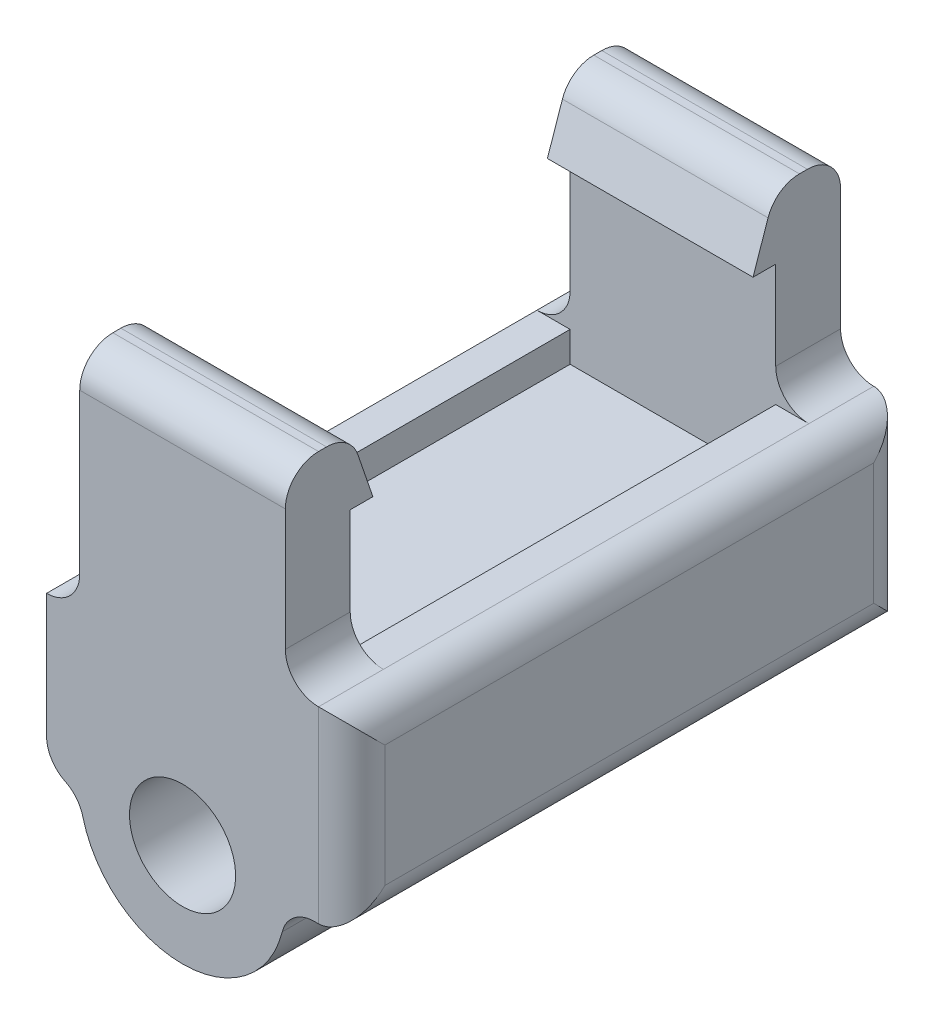
from build123d import *

# Parameters (mm, degrees)
ESBO_O1_R                = 3.1
ESBO_O1_R_2              = 1.55
RESSALTO_EXTRUS_O1_DEPTH = 16.74
BOSS_EXTRUDE1_DEPTH      = 16.74
SKETCH2_W                = 6.2
SKETCH2_H                = 1.955
BOSS_EXTRUDE2_DEPTH      = 7.715
BOSS_EXTRUDE3_DEPTH      = 6.2
SKETCH5_W                = 16.74
SKETCH5_H                = 5.66650546
BOSS_EXTRUDE4_DEPTH      = 2
SKETCH6_W                = 16.74
SKETCH6_H                = 4.529470895
BOSS_EXTRUDE5_DEPTH      = 1
FILLET1_R                = 1
FILLET4_R                = 1
M3_CLEARANCE_HOLE1_D     = 3.2


with BuildPart() as part:
    # Esboço1 → Ressalto-extrusão1 (new body)
    with BuildSketch(Plane.XY):
        with Locations((16.016666667, 16.016666667)):
            Circle(ESBO_O1_R)
        with Locations((16.016666667, 16.016666667)):
            Circle(ESBO_O1_R_2, mode=Mode.SUBTRACT)
    extrude(amount=RESSALTO_EXTRUS_O1_DEPTH)

    # Sketch1 → Boss-Extrude1 (add)
    with BuildSketch(Plane(origin=(0, 0, 0), x_dir=(-1, 0, 0), z_dir=(0, 0, -1))):
        with BuildLine():
            Line((-12.916666667, 16.016666667), (-12.916666667, 19.634677588))
            Line((-12.916666667, 19.634677588), (-19.116666667, 19.634677588))
            Line((-19.116666667, 19.634677588), (-19.116666667, 16.016666667))
            ThreePointArc((-19.116666667, 16.016666667), (-16.016666667, 19.116666667), (-12.916666667, 16.016666667))
        make_face()
    extrude(amount=-BOSS_EXTRUDE1_DEPTH)

    # Sketch2 → Boss-Extrude2 (add)
    with BuildSketch(Plane(origin=(0, 19.634677588, 0), x_dir=(1, 0, 0), z_dir=(0, 1, 0))):
        with Locations((16.016666667, -0.9775)):
            Rectangle(SKETCH2_W, SKETCH2_H)
        with Locations((16.016666667, -15.7625)):
            Rectangle(SKETCH2_W, SKETCH2_H)
    extrude(amount=BOSS_EXTRUDE2_DEPTH)

    # Sketch4 → Boss-Extrude3 (add)
    with BuildSketch(Plane.ZY.offset(-12.916666667)):
        Polygon((1.955, 27.349677588), (1.955, 25.349677588), (2.639300497, 25.349677588), align=None)
        Polygon((14.100699503, 25.349677588), (14.785, 27.349677588), (14.785, 25.349677588), align=None)
    extrude(amount=-BOSS_EXTRUDE3_DEPTH)

    # Sketch5 → Boss-Extrude4 (add)
    with BuildSketch(Plane(origin=(19.116666667, 0, 0), x_dir=(0, 0, -1), z_dir=(1, 0, 0))):
        with Locations((-8.37, 18.849919397)):
            Rectangle(SKETCH5_W, SKETCH5_H)
    extrude(amount=BOSS_EXTRUDE4_DEPTH)

    # Sketch6 → Boss-Extrude5 (add)
    with BuildSketch(Plane.ZY.offset(-12.916666667)):
        with Locations((8.37, 18.281402115)):
            Rectangle(SKETCH6_W, SKETCH6_H)
    extrude(amount=BOSS_EXTRUDE5_DEPTH)

    # Fillet1
    fillet1_edges = [part.edges().sort_by_distance(p)[0] for p in [
        (21.116666667, 21.683172127, 8.37),
        (21.116666667, 18.849919397, 0),
        (21.116666667, 16.016666667, 8.37),
        (21.116666667, 18.849919397, 16.74),
        (16.016666667, 27.349677588, 0),
        (16.016666667, 27.349677588, 1.955),
        (16.016666667, 27.349677588, 16.74),
        (16.016666667, 27.349677588, 14.785),
        (19.116666667, 21.683172127, 15.7625),
        (12.916666667, 20.546137562, 15.7625),
        (12.916666667, 20.546137562, 0.9775),
        (19.116666667, 21.683172127, 0.9775),
        (12.916666667, 16.016666667, 8.37),
        (19.116666667, 16.016666667, 8.37),
    ]]
    fillet(fillet1_edges, radius=FILLET1_R - 0.0001)  # a hair under: the kernel refuses the full size

    # Fillet4
    fillet4_edges = [part.edges().sort_by_distance(p)[0] for p in [
        (11.916666667, 16.016666667, 8.37),
    ]]
    fillet(fillet4_edges, radius=FILLET4_R)

    # M3 Clearance Hole1 (through all)
    with Locations(Plane(origin=(0, 0, 0), x_dir=(-1, 0, 0), z_dir=(0, 0, -1))):
        with Locations((-16.016666667, 16.016666667)):
            Hole(M3_CLEARANCE_HOLE1_D / 2)


solid = part.part
